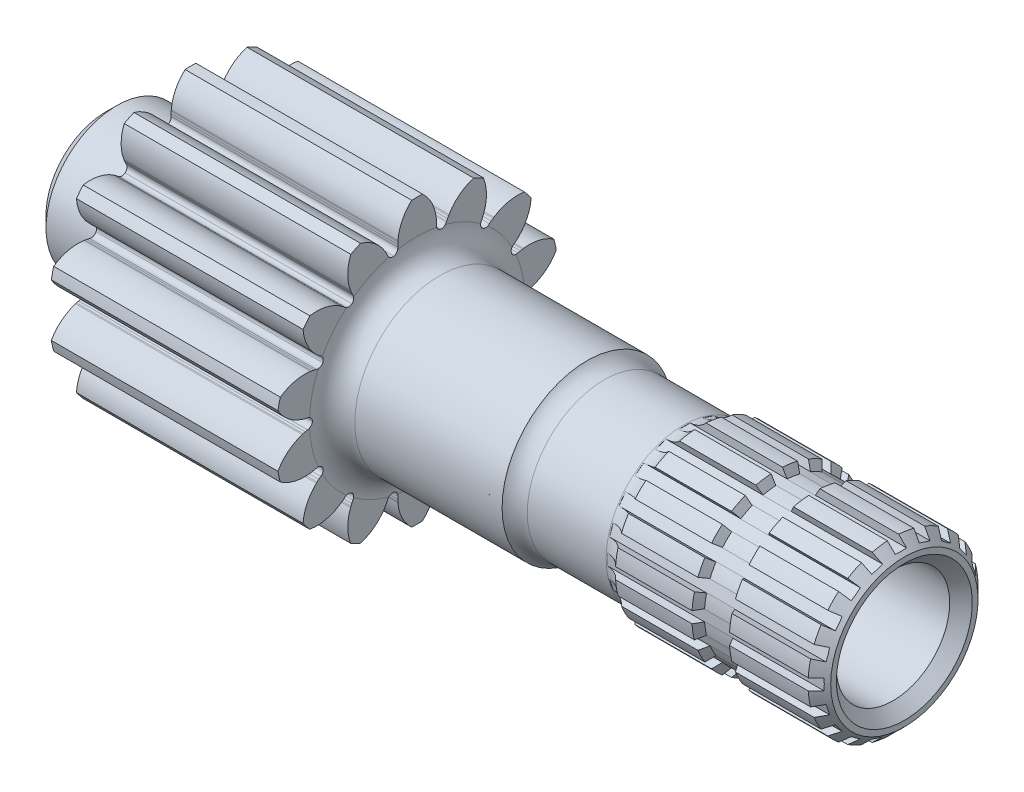
from build123d import *

# Parameters (mm, degrees)
FILLET1_R          = 2.54
CHAMFER1_SIZE      = 1.27
SKETCH2_OUTSIDE_W  = 53.782
SKETCH2_OUTSIDE_H  = 53.782
CUT_EXTRUDE2_DEPTH = 24.638
SKETCH3_R          = 6.35
CUT_EXTRUDE3_DEPTH = 54.356
CHAMFER2_SIZE      = 1.27
SKETCH4_OUTSIDE_W  = 53.782
SKETCH4_OUTSIDE_H  = 53.782
CUT_EXTRUDE5_DEPTH = 29.464
FILLET2_R          = 1.27
SKETCH5_R          = 4.7625
CUT_EXTRUDE6_DEPTH = 6.35
CHAMFER3_SIZE      = 1.27


with BuildPart() as part:
    # Sketch1 → Revolve1 (revolve)
    with BuildSketch(Plane(origin=(0, 0, 0), x_dir=(1, 0, 0), z_dir=(0, 1, 0)), mode=Mode.PRIVATE) as revolve1_sk:
        Polygon((67.31, 0), (67.31, 9.525), (57.218764389, 9.525), (56.7055, 8.636), (53.5305, 8.636), (53.017235611, 9.525), (44.45, 9.525), (44.45, 8.636), (31.75, 8.636), (31.75, 9.525), (12.7, 9.525), (12.7, 15.875), (-12.7, 15.875), (-12.7, 7.9375), (-22.225, 7.9375), (-22.225, 0), align=None)
    revolve(revolve1_sk.sketch.rotate(Axis((-36.50219757, 0, 0), (1, 0, 0)), 180), axis=Axis((-36.50219757, 0, 0), (1, 0, 0)))

    # Fillet1
    # the kernel refuses this fillet: 2.54 mm, written as the material it adds along each edge
    with BuildSketch(Plane(origin=(12.7, 0, 0), x_dir=(0, 0, 1), z_dir=(0, 1, 0))) as fillet1_piece_1:
        with BuildLine():
            CenterArc((9.525 + FILLET1_R, FILLET1_R), FILLET1_R, 180, 90)
            Line((9.525 + FILLET1_R, 0), (9.525 + FILLET1_R, -FILLET1_R * 0.02))
            Line((9.525 + FILLET1_R, -FILLET1_R * 0.02), (9.525 - FILLET1_R * 0.02, -FILLET1_R * 0.02))
            Line((9.525 - FILLET1_R * 0.02, -FILLET1_R * 0.02), (9.525 - FILLET1_R * 0.02, FILLET1_R))
            Line((9.525 - FILLET1_R * 0.02, FILLET1_R), (9.525, FILLET1_R))
        make_face()
    revolve(axis=Axis((12.7, 0, 0), (1, 0, 0)))
    with BuildSketch(Plane(origin=(31.75, 0, 0), x_dir=(0, 0, 1), z_dir=(0, 1, 0))) as fillet1_piece_2:
        with BuildLine():
            CenterArc((11.176, 1.930232888), FILLET1_R, 180, 49.458398126)
            Line((9.525, 0), (9.49198, -0.038604658))
            ThreePointArc((9.49198, -0.038604658), (9.0805, -0.0508), (8.636, -0.0508))
            Line((8.636, -0.0508), (8.5852, 0))
            Line((8.5852, 0), (8.5852, 1.930232888))
            Line((8.5852, 1.930232888), (8.636, 1.930232888))
        make_face()
    revolve(axis=Axis((31.75, 0, 0), (1, 0, 0)))
    with BuildSketch(Plane(origin=(44.45, 0, 0), x_dir=(0, 0, 1), z_dir=(0, 1, 0))) as fillet1_piece_3:
        with BuildLine():
            CenterArc((11.176, -1.930232888), FILLET1_R, 130.541601874, 49.458398126)
            Line((8.636, -1.930232888), (8.5852, -1.930232888))
            Line((8.5852, -1.930232888), (8.5852, 0))
            Line((8.5852, 0), (8.636, 0.0508))
            ThreePointArc((8.636, 0.0508), (9.0805, 0.0508), (9.49198, 0.038604658))
            Line((9.49198, 0.038604658), (9.525, 0))
        make_face()
    revolve(axis=Axis((44.45, 0, 0), (1, 0, 0)))

    # Chamfer1
    chamfer1_edges = [part.edges().sort_by_distance(p)[0] for p in [
        (-22.225, 0, -7.9375),
        (67.31, 0, -9.525),
    ]]
    chamfer(chamfer1_edges, length=CHAMFER1_SIZE)

    # Sketch2 outside → Cut-Extrude2 (cut)
    with BuildSketch(Plane(origin=(67.31, 0, 0), x_dir=(0, 0, -1), z_dir=(1, 0, 0))):
        Rectangle(SKETCH2_OUTSIDE_W, SKETCH2_OUTSIDE_H)
        with BuildLine():
            Line((-0.635, 8.614809762), (0.635, 8.614809762))
            Line((0.635, 8.614809762), (0.635, 9.503809762))
            ThreePointArc((0.635, 9.503809762), (1.49003828, 9.407731444), (2.33291784, 9.234885996))
            Line((2.33291784, 9.234885996), (2.058201732, 8.389396753))
            Line((2.058201732, 8.389396753), (3.266043508, 7.99694517))
            Line((3.266043508, 7.99694517), (3.540759616, 8.842434413))
            ThreePointArc((3.540759616, 8.842434413), (4.32425951, 8.486837143), (5.072473428, 8.061987244))
            Line((5.072473428, 8.061987244), (4.549932338, 7.342771136))
            Line((4.549932338, 7.342771136), (5.577383921, 6.596283866))
            Line((5.577383921, 6.596283866), (6.09992501, 7.315499974))
            ThreePointArc((6.09992501, 7.315499974), (6.735192091, 6.735192091), (7.315499974, 6.09992501))
            Line((7.315499974, 6.09992501), (6.596283866, 5.577383921))
            Line((6.596283866, 5.577383921), (7.342771136, 4.549932338))
            Line((7.342771136, 4.549932338), (8.061987244, 5.072473428))
            ThreePointArc((8.061987244, 5.072473428), (8.486837143, 4.32425951), (8.842434413, 3.540759616))
            Line((8.842434413, 3.540759616), (7.99694517, 3.266043508))
            Line((7.99694517, 3.266043508), (8.389396753, 2.058201732))
            Line((8.389396753, 2.058201732), (9.234885996, 2.33291784))
            ThreePointArc((9.234885996, 2.33291784), (9.407731444, 1.49003828), (9.503809762, 0.635))
            Line((9.503809762, 0.635), (8.614809762, 0.635))
            Line((8.614809762, 0.635), (8.614809762, -0.635))
            Line((8.614809762, -0.635), (9.503809762, -0.635))
            ThreePointArc((9.503809762, -0.635), (9.407731444, -1.49003828), (9.234885996, -2.33291784))
            Line((9.234885996, -2.33291784), (8.389396753, -2.058201732))
            Line((8.389396753, -2.058201732), (7.99694517, -3.266043508))
            Line((7.99694517, -3.266043508), (8.842434413, -3.540759616))
            ThreePointArc((8.842434413, -3.540759616), (8.486837143, -4.32425951), (8.061987244, -5.072473428))
            Line((8.061987244, -5.072473428), (7.342771136, -4.549932338))
            Line((7.342771136, -4.549932338), (6.596283866, -5.577383921))
            Line((6.596283866, -5.577383921), (7.315499974, -6.09992501))
            ThreePointArc((7.315499974, -6.09992501), (6.735192091, -6.735192091), (6.09992501, -7.315499974))
            Line((6.09992501, -7.315499974), (5.577383921, -6.596283866))
            Line((5.577383921, -6.596283866), (4.549932338, -7.342771136))
            Line((4.549932338, -7.342771136), (5.072473428, -8.061987244))
            ThreePointArc((5.072473428, -8.061987244), (4.32425951, -8.486837143), (3.540759616, -8.842434413))
            Line((3.540759616, -8.842434413), (3.266043508, -7.99694517))
            Line((3.266043508, -7.99694517), (2.058201732, -8.389396753))
            Line((2.058201732, -8.389396753), (2.33291784, -9.234885996))
            ThreePointArc((2.33291784, -9.234885996), (1.49003828, -9.407731444), (0.635, -9.503809762))
            Line((0.635, -9.503809762), (0.635, -8.614809762))
            Line((0.635, -8.614809762), (-0.635, -8.614809762))
            Line((-0.635, -8.614809762), (-0.635, -9.503809762))
            ThreePointArc((-0.635, -9.503809762), (-1.49003828, -9.407731444), (-2.33291784, -9.234885996))
            Line((-2.33291784, -9.234885996), (-2.058201732, -8.389396753))
            Line((-2.058201732, -8.389396753), (-3.266043508, -7.99694517))
            Line((-3.266043508, -7.99694517), (-3.540759616, -8.842434413))
            ThreePointArc((-3.540759616, -8.842434413), (-4.32425951, -8.486837143), (-5.072473428, -8.061987244))
            Line((-5.072473428, -8.061987244), (-4.549932338, -7.342771136))
            Line((-4.549932338, -7.342771136), (-5.577383921, -6.596283866))
            Line((-5.577383921, -6.596283866), (-6.09992501, -7.315499974))
            ThreePointArc((-6.09992501, -7.315499974), (-6.735192091, -6.735192091), (-7.315499974, -6.09992501))
            Line((-7.315499974, -6.09992501), (-6.596283866, -5.577383921))
            Line((-6.596283866, -5.577383921), (-7.342771136, -4.549932338))
            Line((-7.342771136, -4.549932338), (-8.061987244, -5.072473428))
            ThreePointArc((-8.061987244, -5.072473428), (-8.486837143, -4.32425951), (-8.842434413, -3.540759616))
            Line((-8.842434413, -3.540759616), (-7.99694517, -3.266043508))
            Line((-7.99694517, -3.266043508), (-8.389396753, -2.058201732))
            Line((-8.389396753, -2.058201732), (-9.234885996, -2.33291784))
            ThreePointArc((-9.234885996, -2.33291784), (-9.407731444, -1.49003828), (-9.503809762, -0.635))
            Line((-9.503809762, -0.635), (-8.614809762, -0.635))
            Line((-8.614809762, -0.635), (-8.614809762, 0.635))
            Line((-8.614809762, 0.635), (-9.503809762, 0.635))
            ThreePointArc((-9.503809762, 0.635), (-9.407731444, 1.49003828), (-9.234885996, 2.33291784))
            Line((-9.234885996, 2.33291784), (-8.389396753, 2.058201732))
            Line((-8.389396753, 2.058201732), (-7.99694517, 3.266043508))
            Line((-7.99694517, 3.266043508), (-8.842434413, 3.540759616))
            ThreePointArc((-8.842434413, 3.540759616), (-8.486837143, 4.32425951), (-8.061987244, 5.072473428))
            Line((-8.061987244, 5.072473428), (-7.342771136, 4.549932338))
            Line((-7.342771136, 4.549932338), (-6.596283866, 5.577383921))
            Line((-6.596283866, 5.577383921), (-7.315499974, 6.09992501))
            ThreePointArc((-7.315499974, 6.09992501), (-6.735192091, 6.735192091), (-6.09992501, 7.315499974))
            Line((-6.09992501, 7.315499974), (-5.577383921, 6.596283866))
            Line((-5.577383921, 6.596283866), (-4.549932338, 7.342771136))
            Line((-4.549932338, 7.342771136), (-5.072473428, 8.061987244))
            ThreePointArc((-5.072473428, 8.061987244), (-4.32425951, 8.486837143), (-3.540759616, 8.842434413))
            Line((-3.540759616, 8.842434413), (-3.266043508, 7.99694517))
            Line((-3.266043508, 7.99694517), (-2.058201732, 8.389396753))
            Line((-2.058201732, 8.389396753), (-2.33291784, 9.234885996))
            ThreePointArc((-2.33291784, 9.234885996), (-1.49003828, 9.407731444), (-0.635, 9.503809762))
            Line((-0.635, 9.503809762), (-0.635, 8.614809762))
        make_face(mode=Mode.SUBTRACT)
    extrude(amount=-CUT_EXTRUDE2_DEPTH, mode=Mode.SUBTRACT)

    # Sketch3 → Cut-Extrude3 (cut)
    with BuildSketch(Plane(origin=(67.31, 0, 0), x_dir=(0, 0, -1), z_dir=(1, 0, 0))):
        Circle(SKETCH3_R)
    extrude(amount=-CUT_EXTRUDE3_DEPTH, mode=Mode.SUBTRACT)

    # Chamfer2
    chamfer2_edges = [part.edges().sort_by_distance(p)[0] for p in [
        (67.31, 0, 6.35),
    ]]
    chamfer(chamfer2_edges, length=CHAMFER2_SIZE)

    # Sketch4 outside → Cut-Extrude5 (cut)
    with BuildSketch(Plane.ZY.offset(12.7)):
        Rectangle(SKETCH4_OUTSIDE_W, SKETCH4_OUTSIDE_H)
        with BuildLine():
            Line((2.158270596, 12.606269679), (2.167147448, 12.36639613))
            ThreePointArc((2.167147448, 12.36639613), (2.168475444, 12.226859028), (2.16213839, 12.087459573))
            ThreePointArc((2.16213839, 12.087459573), (2.273808356, 11.688892129), (2.614143704, 11.45331191))
            ThreePointArc((2.614143704, 11.45331191), (3.022989683, 11.51789638), (3.296532779, 11.828541456))
            ThreePointArc((3.296532779, 11.828541456), (3.351306447, 11.95688557), (3.41304581, 12.082027959))
            Line((3.41304581, 12.082027959), (3.525120809, 12.294295037))
            ThreePointArc((3.525120809, 12.294295037), (3.553325833, 12.346241529), (3.582732013, 12.397517623))
            ThreePointArc((3.582732013, 12.397517623), (4.755575447, 13.736887569), (6.336468509, 14.555575971))
            ThreePointArc((6.336468509, 14.555575971), (6.887904358, 14.302880778), (7.429284044, 14.029303746))
            ThreePointArc((7.429284044, 14.029303746), (7.77487838, 12.28286791), (7.45897271, 10.530818487))
            ThreePointArc((7.45897271, 10.530818487), (7.437217898, 10.475857688), (7.41419004, 10.421418005))
            Line((7.41419004, 10.421418005), (7.318110575, 10.201447884))
            ThreePointArc((7.318110575, 10.201447884), (7.258764178, 10.075153103), (7.192571533, 9.952308078))
            ThreePointArc((7.192571533, 9.952308078), (7.120250763, 9.544759437), (7.32466789, 9.18484302))
            ThreePointArc((7.32466789, 9.18484302), (7.72104754, 9.065639995), (8.102285201, 9.226835636))
            ThreePointArc((8.102285201, 9.226835636), (8.207320995, 9.318704284), (8.317243487, 9.404665975))
            Line((8.317243487, 9.404665975), (8.510318805, 9.547284484))
            ThreePointArc((8.510318805, 9.547284484), (8.558269391, 9.581848954), (8.607011308, 9.615288256))
            ThreePointArc((8.607011308, 9.615288256), (10.244837569, 10.313141185), (12.024388586, 10.364830154))
            ThreePointArc((12.024388586, 10.364830154), (12.411574784, 9.897900605), (12.780640401, 9.416520373))
            ThreePointArc((12.780640401, 9.416520373), (12.334260028, 7.693088293), (11.289453099, 6.251612641))
            ThreePointArc((11.289453099, 6.251612641), (11.246006094, 6.211533731), (11.201638218, 6.172476685))
            Line((11.201638218, 6.172476685), (11.019632152, 6.015977771))
            ThreePointArc((11.019632152, 6.015977771), (10.911365645, 5.927939542), (10.798427673, 5.845979912))
            ThreePointArc((10.798427673, 5.845979912), (10.556440183, 5.51017008), (10.584451769, 5.097203326))
            ThreePointArc((10.584451769, 5.097203326), (10.88985724, 4.817822426), (11.303280671, 4.797641859))
            ThreePointArc((11.303280671, 4.797641859), (11.437774964, 4.834839327), (11.574109087, 4.864594553))
            Line((11.574109087, 4.864594553), (11.80994379, 4.909317149))
            ThreePointArc((11.80994379, 4.909317149), (11.868142737, 4.919653681), (11.926566455, 4.928633126))
            ThreePointArc((11.926566455, 4.928633126), (13.704983966, 4.846750707), (15.330731034, 4.12120261))
            ThreePointArc((15.330731034, 4.12120261), (15.476980606, 3.532519827), (15.600634182, 2.938679655))
            ThreePointArc((15.600634182, 2.938679655), (14.450690208, 1.57959819), (12.883918846, 0.734198241))
            ThreePointArc((12.883918846, 0.734198241), (12.82738486, 0.71693934), (12.770464567, 0.701000657))
            Line((12.770464567, 0.701000657), (12.538580435, 0.63896948))
            ThreePointArc((12.538580435, 0.63896948), (12.402837326, 0.606624853), (12.265522779, 0.581783727))
            ThreePointArc((12.265522779, 0.581783727), (11.901797158, 0.38422396), (11.747855166, 0))
            ThreePointArc((11.747855166, 0), (11.901797158, -0.38422396), (12.265522779, -0.581783727))
            ThreePointArc((12.265522779, -0.581783727), (12.402837326, -0.606624853), (12.538580435, -0.63896948))
            Line((12.538580435, -0.63896948), (12.770464567, -0.701000657))
            ThreePointArc((12.770464567, -0.701000657), (12.82738486, -0.71693934), (12.883918846, -0.734198241))
            ThreePointArc((12.883918846, -0.734198241), (14.450690208, -1.57959819), (15.600634182, -2.938679655))
            ThreePointArc((15.600634182, -2.938679655), (15.476980606, -3.532519827), (15.330731034, -4.12120261))
            ThreePointArc((15.330731034, -4.12120261), (13.704983966, -4.846750707), (11.926566455, -4.928633126))
            ThreePointArc((11.926566455, -4.928633126), (11.868142737, -4.919653681), (11.80994379, -4.909317149))
            Line((11.80994379, -4.909317149), (11.574109087, -4.864594553))
            ThreePointArc((11.574109087, -4.864594553), (11.437774964, -4.834839327), (11.303280671, -4.797641859))
            ThreePointArc((11.303280671, -4.797641859), (10.88985724, -4.817822426), (10.584451769, -5.097203326))
            ThreePointArc((10.584451769, -5.097203326), (10.556440183, -5.51017008), (10.798427673, -5.845979912))
            ThreePointArc((10.798427673, -5.845979912), (10.911365645, -5.927939542), (11.019632152, -6.015977771))
            Line((11.019632152, -6.015977771), (11.201638218, -6.172476685))
            ThreePointArc((11.201638218, -6.172476685), (11.246006094, -6.211533731), (11.289453099, -6.251612641))
            ThreePointArc((11.289453099, -6.251612641), (12.334260028, -7.693088293), (12.780640401, -9.416520373))
            ThreePointArc((12.780640401, -9.416520373), (12.411574784, -9.897900605), (12.024388586, -10.364830154))
            ThreePointArc((12.024388586, -10.364830154), (10.244837569, -10.313141185), (8.607011308, -9.615288256))
            ThreePointArc((8.607011308, -9.615288256), (8.558269391, -9.581848954), (8.510318805, -9.547284484))
            Line((8.510318805, -9.547284484), (8.317243487, -9.404665975))
            ThreePointArc((8.317243487, -9.404665975), (8.207320995, -9.318704284), (8.102285201, -9.226835636))
            ThreePointArc((8.102285201, -9.226835636), (7.72104754, -9.065639995), (7.32466789, -9.184843021))
            ThreePointArc((7.32466789, -9.184843021), (7.120250763, -9.544759437), (7.192571533, -9.952308078))
            ThreePointArc((7.192571533, -9.952308078), (7.258764178, -10.075153103), (7.318110575, -10.201447884))
            Line((7.318110575, -10.201447884), (7.41419004, -10.421418005))
            ThreePointArc((7.41419004, -10.421418005), (7.437217898, -10.475857688), (7.45897271, -10.530818487))
            ThreePointArc((7.45897271, -10.530818487), (7.77487838, -12.28286791), (7.429284044, -14.029303746))
            ThreePointArc((7.429284044, -14.029303746), (6.887904358, -14.302880778), (6.336468509, -14.555575971))
            ThreePointArc((6.336468509, -14.555575971), (4.755575447, -13.736887569), (3.582732013, -12.397517623))
            ThreePointArc((3.582732013, -12.397517623), (3.553325833, -12.346241529), (3.525120809, -12.294295037))
            Line((3.525120809, -12.294295037), (3.41304581, -12.082027959))
            ThreePointArc((3.41304581, -12.082027959), (3.351306447, -11.95688557), (3.296532779, -11.828541456))
            ThreePointArc((3.296532779, -11.828541456), (3.022989683, -11.51789638), (2.614143703, -11.45331191))
            ThreePointArc((2.614143703, -11.45331191), (2.273808356, -11.688892129), (2.16213839, -12.087459573))
            ThreePointArc((2.16213839, -12.087459573), (2.168475444, -12.226859028), (2.167147448, -12.36639613))
            Line((2.167147448, -12.36639613), (2.158270596, -12.606269679))
            ThreePointArc((2.158270596, -12.606269679), (2.155397486, -12.665309551), (2.151151297, -12.72426658))
            ThreePointArc((2.151151297, -12.72426658), (1.675586716, -14.439874898), (0.606466868, -15.863411453))
            ThreePointArc((0.606466868, -15.863411453), (0, -15.875), (-0.606466868, -15.863411453))
            ThreePointArc((-0.606466868, -15.863411453), (-1.675586716, -14.439874898), (-2.151151297, -12.72426658))
            ThreePointArc((-2.151151297, -12.72426658), (-2.155397486, -12.665309551), (-2.158270596, -12.606269679))
            Line((-2.158270596, -12.606269679), (-2.167147448, -12.36639613))
            ThreePointArc((-2.167147448, -12.36639613), (-2.168475444, -12.226859028), (-2.16213839, -12.087459573))
            ThreePointArc((-2.16213839, -12.087459573), (-2.273808356, -11.688892129), (-2.614143704, -11.45331191))
            ThreePointArc((-2.614143704, -11.45331191), (-3.022989683, -11.51789638), (-3.296532779, -11.828541456))
            ThreePointArc((-3.296532779, -11.828541456), (-3.351306447, -11.95688557), (-3.41304581, -12.082027959))
            Line((-3.41304581, -12.082027959), (-3.525120809, -12.294295037))
            ThreePointArc((-3.525120809, -12.294295037), (-3.553325833, -12.346241529), (-3.582732013, -12.397517623))
            ThreePointArc((-3.582732013, -12.397517623), (-4.755575447, -13.736887569), (-6.336468509, -14.555575971))
            ThreePointArc((-6.336468509, -14.555575971), (-6.887904358, -14.302880778), (-7.429284044, -14.029303746))
            ThreePointArc((-7.429284044, -14.029303746), (-7.77487838, -12.28286791), (-7.45897271, -10.530818487))
            ThreePointArc((-7.45897271, -10.530818487), (-7.437217898, -10.475857688), (-7.41419004, -10.421418005))
            Line((-7.41419004, -10.421418005), (-7.318110575, -10.201447884))
            ThreePointArc((-7.318110575, -10.201447884), (-7.258764178, -10.075153103), (-7.192571533, -9.952308078))
            ThreePointArc((-7.192571533, -9.952308078), (-7.120250763, -9.544759437), (-7.32466789, -9.18484302))
            ThreePointArc((-7.32466789, -9.18484302), (-7.72104754, -9.065639995), (-8.102285201, -9.226835636))
            ThreePointArc((-8.102285201, -9.226835636), (-8.207320995, -9.318704284), (-8.317243487, -9.404665975))
            Line((-8.317243487, -9.404665975), (-8.510318805, -9.547284484))
            ThreePointArc((-8.510318805, -9.547284484), (-8.558269391, -9.581848954), (-8.607011308, -9.615288256))
            ThreePointArc((-8.607011308, -9.615288256), (-10.244837569, -10.313141185), (-12.024388586, -10.364830154))
            ThreePointArc((-12.024388586, -10.364830154), (-12.411574784, -9.897900605), (-12.780640401, -9.416520373))
            ThreePointArc((-12.780640401, -9.416520373), (-12.334260028, -7.693088293), (-11.289453099, -6.251612641))
            ThreePointArc((-11.289453099, -6.251612641), (-11.246006094, -6.211533731), (-11.201638218, -6.172476685))
            Line((-11.201638218, -6.172476685), (-11.019632152, -6.015977771))
            ThreePointArc((-11.019632152, -6.015977771), (-10.911365645, -5.927939542), (-10.798427673, -5.845979912))
            ThreePointArc((-10.798427673, -5.845979912), (-10.556440183, -5.51017008), (-10.584451769, -5.097203326))
            ThreePointArc((-10.584451769, -5.097203326), (-10.88985724, -4.817822426), (-11.303280671, -4.797641859))
            ThreePointArc((-11.303280671, -4.797641859), (-11.437774964, -4.834839327), (-11.574109087, -4.864594553))
            Line((-11.574109087, -4.864594553), (-11.80994379, -4.909317149))
            ThreePointArc((-11.80994379, -4.909317149), (-11.868142737, -4.919653681), (-11.926566455, -4.928633126))
            ThreePointArc((-11.926566455, -4.928633126), (-13.704983966, -4.846750707), (-15.330731034, -4.12120261))
            ThreePointArc((-15.330731034, -4.12120261), (-15.476980606, -3.532519827), (-15.600634182, -2.938679655))
            ThreePointArc((-15.600634182, -2.938679655), (-14.450690208, -1.57959819), (-12.883918846, -0.734198241))
            ThreePointArc((-12.883918846, -0.734198241), (-12.82738486, -0.71693934), (-12.770464567, -0.701000657))
            Line((-12.770464567, -0.701000657), (-12.538580435, -0.63896948))
            ThreePointArc((-12.538580435, -0.63896948), (-12.402837326, -0.606624853), (-12.265522779, -0.581783727))
            ThreePointArc((-12.265522779, -0.581783727), (-11.901797158, -0.38422396), (-11.747855166, 0))
            ThreePointArc((-11.747855166, 0), (-11.901797158, 0.38422396), (-12.265522779, 0.581783727))
            ThreePointArc((-12.265522779, 0.581783727), (-12.402837326, 0.606624853), (-12.538580435, 0.63896948))
            Line((-12.538580435, 0.63896948), (-12.770464567, 0.701000657))
            ThreePointArc((-12.770464567, 0.701000657), (-12.82738486, 0.71693934), (-12.883918846, 0.734198241))
            ThreePointArc((-12.883918846, 0.734198241), (-14.450690208, 1.57959819), (-15.600634182, 2.938679655))
            ThreePointArc((-15.600634182, 2.938679655), (-15.476980606, 3.532519827), (-15.330731034, 4.12120261))
            ThreePointArc((-15.330731034, 4.12120261), (-13.704983966, 4.846750707), (-11.926566455, 4.928633126))
            ThreePointArc((-11.926566455, 4.928633126), (-11.868142737, 4.919653681), (-11.80994379, 4.909317149))
            Line((-11.80994379, 4.909317149), (-11.574109087, 4.864594553))
            ThreePointArc((-11.574109087, 4.864594553), (-11.437774964, 4.834839327), (-11.303280671, 4.797641859))
            ThreePointArc((-11.303280671, 4.797641859), (-10.88985724, 4.817822426), (-10.584451769, 5.097203326))
            ThreePointArc((-10.584451769, 5.097203326), (-10.556440183, 5.51017008), (-10.798427673, 5.845979912))
            ThreePointArc((-10.798427673, 5.845979912), (-10.911365645, 5.927939542), (-11.019632152, 6.015977771))
            Line((-11.019632152, 6.015977771), (-11.201638218, 6.172476685))
            ThreePointArc((-11.201638218, 6.172476685), (-11.246006094, 6.211533731), (-11.289453099, 6.251612641))
            ThreePointArc((-11.289453099, 6.251612641), (-12.334260028, 7.693088293), (-12.780640401, 9.416520373))
            ThreePointArc((-12.780640401, 9.416520373), (-12.411574784, 9.897900605), (-12.024388586, 10.364830154))
            ThreePointArc((-12.024388586, 10.364830154), (-10.244837569, 10.313141185), (-8.607011308, 9.615288256))
            ThreePointArc((-8.607011308, 9.615288256), (-8.558269391, 9.581848954), (-8.510318805, 9.547284484))
            Line((-8.510318805, 9.547284484), (-8.317243487, 9.404665975))
            ThreePointArc((-8.317243487, 9.404665975), (-8.207320995, 9.318704284), (-8.102285201, 9.226835636))
            ThreePointArc((-8.102285201, 9.226835636), (-7.72104754, 9.065639995), (-7.32466789, 9.18484302))
            ThreePointArc((-7.32466789, 9.18484302), (-7.120250763, 9.544759437), (-7.192571533, 9.952308078))
            ThreePointArc((-7.192571533, 9.952308078), (-7.258764178, 10.075153103), (-7.318110575, 10.201447884))
            Line((-7.318110575, 10.201447884), (-7.41419004, 10.421418005))
            ThreePointArc((-7.41419004, 10.421418005), (-7.437217898, 10.475857688), (-7.45897271, 10.530818487))
            ThreePointArc((-7.45897271, 10.530818487), (-7.77487838, 12.28286791), (-7.429284044, 14.029303746))
            ThreePointArc((-7.429284044, 14.029303746), (-6.887904358, 14.302880778), (-6.336468509, 14.555575971))
            ThreePointArc((-6.336468509, 14.555575971), (-4.755575447, 13.736887569), (-3.582732013, 12.397517623))
            ThreePointArc((-3.582732013, 12.397517623), (-3.553325833, 12.346241529), (-3.525120809, 12.294295037))
            Line((-3.525120809, 12.294295037), (-3.41304581, 12.082027959))
            ThreePointArc((-3.41304581, 12.082027959), (-3.351306447, 11.95688557), (-3.296532779, 11.828541456))
            ThreePointArc((-3.296532779, 11.828541456), (-3.022989683, 11.51789638), (-2.614143704, 11.45331191))
            ThreePointArc((-2.614143704, 11.45331191), (-2.273808356, 11.688892129), (-2.16213839, 12.087459573))
            ThreePointArc((-2.16213839, 12.087459573), (-2.168475444, 12.226859028), (-2.167147448, 12.36639613))
            Line((-2.167147448, 12.36639613), (-2.158270596, 12.606269679))
            ThreePointArc((-2.158270596, 12.606269679), (-2.155397486, 12.665309551), (-2.151151297, 12.72426658))
            ThreePointArc((-2.151151297, 12.72426658), (-1.675586716, 14.439874898), (-0.606466868, 15.863411453))
            ThreePointArc((-0.606466868, 15.863411453), (0, 15.875), (0.606466868, 15.863411453))
            ThreePointArc((0.606466868, 15.863411453), (1.675586716, 14.439874898), (2.151151297, 12.72426658))
            ThreePointArc((2.151151297, 12.72426658), (2.155397486, 12.665309551), (2.158270596, 12.606269679))
        make_face(mode=Mode.SUBTRACT)
    extrude(amount=-CUT_EXTRUDE5_DEPTH, mode=Mode.SUBTRACT)

    # Fillet2
    fillet2_edges = [part.edges().sort_by_distance(p)[0] for p in [
        (-12.7, 0, -7.9375),
    ]]
    fillet(fillet2_edges, radius=FILLET2_R)

    # Sketch5 → Cut-Extrude6 (cut)
    with BuildSketch(Plane.ZY.offset(22.225)):
        Circle(SKETCH5_R)
    extrude(amount=-CUT_EXTRUDE6_DEPTH, mode=Mode.SUBTRACT)

    # Chamfer3
    chamfer3_edges = [part.edges().sort_by_distance(p)[0] for p in [
        (-22.225, 0, -4.7625),
    ]]
    chamfer(chamfer3_edges, length=CHAMFER3_SIZE)


solid = part.part
